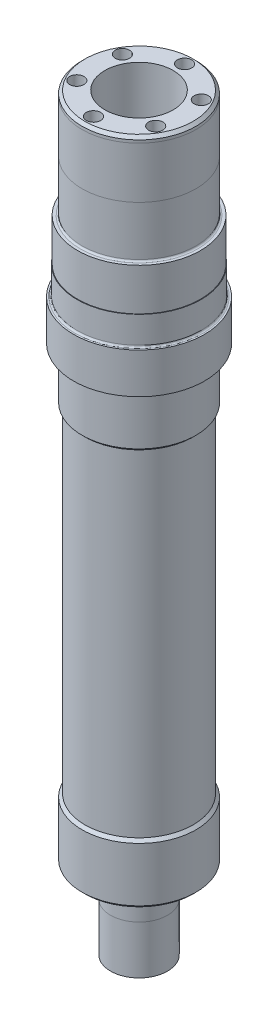
from build123d import *

# Parameters (mm, degrees)
SKETCH4_W                     = 1.6
SKETCH4_H                     = 120
M3_CLEARANCE_HOLE1_AT_2_COUNT = 2
M3_CLEARANCE_HOLE1_AT_2_PITCH = 8
M3_CLEARANCE_HOLE1_AT_3_COUNT = 2
M3_CLEARANCE_HOLE1_AT_3_PITCH = 13.856406461
M3_CLEARANCE_HOLE1_AT_4_COUNT = 2
M3_CLEARANCE_HOLE1_AT_4_PITCH = 16
M3_CLEARANCE_HOLE1_AT_5_COUNT = 2
M3_CLEARANCE_HOLE1_AT_5_PITCH = 13.856406461
M3_CLEARANCE_HOLE1_AT_6_COUNT = 2
M3_CLEARANCE_HOLE1_AT_6_PITCH = 8
M3_TAPPED_HOLE1_AT_2_COUNT    = 2
M3_TAPPED_HOLE1_AT_2_PITCH    = 8
M3_TAPPED_HOLE1_AT_3_COUNT    = 2
M3_TAPPED_HOLE1_AT_3_PITCH    = 13.856406461
M3_TAPPED_HOLE1_AT_4_COUNT    = 2
M3_TAPPED_HOLE1_AT_4_PITCH    = 8
M3_TAPPED_HOLE1_AT_5_COUNT    = 2
M3_TAPPED_HOLE1_AT_5_PITCH    = 13.856406461
M3_TAPPED_HOLE1_AT_6_COUNT    = 2
M3_TAPPED_HOLE1_AT_6_PITCH    = 16
SKETCH15_W                    = 1.6
SKETCH15_H                    = 134
M3_CLEARANCE_HOLE2_AT_2_COUNT = 2
M3_CLEARANCE_HOLE2_AT_2_PITCH = 8
M3_CLEARANCE_HOLE2_AT_3_COUNT = 2
M3_CLEARANCE_HOLE2_AT_3_PITCH = 13.856406461
M3_CLEARANCE_HOLE2_AT_4_COUNT = 2
M3_CLEARANCE_HOLE2_AT_4_PITCH = 16
M3_CLEARANCE_HOLE2_AT_5_COUNT = 2
M3_CLEARANCE_HOLE2_AT_5_PITCH = 13.856406461
M3_CLEARANCE_HOLE2_AT_6_COUNT = 2
M3_CLEARANCE_HOLE2_AT_6_PITCH = 8
M3_TAPPED_HOLE2_AT_2_COUNT    = 2
M3_TAPPED_HOLE2_AT_2_PITCH    = 8
M3_TAPPED_HOLE2_AT_3_COUNT    = 2
M3_TAPPED_HOLE2_AT_3_PITCH    = 13.856406461
M3_TAPPED_HOLE2_AT_4_COUNT    = 2
M3_TAPPED_HOLE2_AT_4_PITCH    = 16
M3_TAPPED_HOLE2_AT_5_COUNT    = 2
M3_TAPPED_HOLE2_AT_5_PITCH    = 13.856406461
M3_TAPPED_HOLE2_AT_6_COUNT    = 2
M3_TAPPED_HOLE2_AT_6_PITCH    = 8
CHAMFER1_SIZE                 = 0.5
FILLET1_R                     = 0.3
FILLET2_R                     = 0.3
FILLET3_R                     = 0.4
CHAMFER2_SIZE                 = 0.5
FILLET4_R                     = 0.3
FILLET5_R                     = 0.3


with BuildPart() as part:
    # Sketch1 → Revolve1 (revolve)
    with BuildSketch(Plane(origin=(0, 0, 0), x_dir=(0, 0, -1), z_dir=(1, 0, 0))):
        Polygon((-15, 84), (-15, 65), (-14.2, 65), (-14.2, 57.6), (-14.1, 57.6), (-14.1, 52.6), (-13.5, 52.6), (-13.5, 45.5), (-15, 45.5), (-15, 36.5), (-15.5, 36.5), (-15.5, -23.5), (-15, -23.5), (-15, -33.5), (-19, -33.5), (-20, -33.5), (-20, -47.5), (-25, -47.5), (-25, -23.5), (-19, -23.5), (-19, 83), (-19, 84), align=None)
    revolve(axis=Axis((0, -55.813956753, 25), (0, 1, 0)))

    # Sketch8 → M3 Tapped Hole1 (revolve, cut)
    with BuildSketch(Plane(origin=(0, -33.5, 17), x_dir=(0, 0, -1), z_dir=(1, 0, 0))):
        Polygon((0, 0), (0, 9.251075774), (1.25, 8.5), (1.25, 0), align=None)
    m3_tapped_hole1 = revolve(axis=Axis((0, -39.85, 17), (0, 1, 0)), mode=Mode.SUBTRACT)

    # M3 Tapped Hole1 at 2: M3 Tapped Hole1 ×2
    with Locations(*[Vector(0.8660254037844389, 0, 0.4999999999999998) * (i * M3_TAPPED_HOLE1_AT_2_PITCH) for i in range(1, M3_TAPPED_HOLE1_AT_2_COUNT)]):
        add(m3_tapped_hole1, mode=Mode.SUBTRACT)

    # M3 Tapped Hole1 at 3: M3 Tapped Hole1 ×2
    with Locations(*[Vector(0.4999999999999999, 0, 0.8660254037844387) * (i * M3_TAPPED_HOLE1_AT_3_PITCH) for i in range(1, M3_TAPPED_HOLE1_AT_3_COUNT)]):
        add(m3_tapped_hole1, mode=Mode.SUBTRACT)

    # M3 Tapped Hole1 at 4: M3 Tapped Hole1 ×2
    with Locations(*[Vector(-0.8660254037844389, 0, 0.49999999999999956) * (i * M3_TAPPED_HOLE1_AT_4_PITCH) for i in range(1, M3_TAPPED_HOLE1_AT_4_COUNT)]):
        add(m3_tapped_hole1, mode=Mode.SUBTRACT)

    # M3 Tapped Hole1 at 5: M3 Tapped Hole1 ×2
    with Locations(*[Vector(-0.5000000000000003, 0, 0.8660254037844385) * (i * M3_TAPPED_HOLE1_AT_5_PITCH) for i in range(1, M3_TAPPED_HOLE1_AT_5_COUNT)]):
        add(m3_tapped_hole1, mode=Mode.SUBTRACT)

    # M3 Tapped Hole1 at 6: M3 Tapped Hole1 ×2
    with Locations(*[(0, 0, i * M3_TAPPED_HOLE1_AT_6_PITCH) for i in range(1, M3_TAPPED_HOLE1_AT_6_COUNT)]):
        add(m3_tapped_hole1, mode=Mode.SUBTRACT)

    # Sketch20 → M3 Tapped Hole2 (revolve, cut)
    with BuildSketch(Plane(origin=(-6.92820323, 84, 29), x_dir=(0, 0, 1), z_dir=(1, 0, 0))):
        Polygon((0, 0), (0, 8.251075774), (1.25, 7.5), (1.25, 0), align=None)
    m3_tapped_hole2 = revolve(axis=Axis((-6.92820323, 90.35, 29), (0, -1, 0)), mode=Mode.SUBTRACT)

    # M3 Tapped Hole2 at 2: M3 Tapped Hole2 ×2
    with Locations(*[Vector(0.8660254037844393, 0, 0.49999999999999906) * (i * M3_TAPPED_HOLE2_AT_2_PITCH) for i in range(1, M3_TAPPED_HOLE2_AT_2_COUNT)]):
        add(m3_tapped_hole2, mode=Mode.SUBTRACT)

    # M3 Tapped Hole2 at 3: M3 Tapped Hole2 ×2
    with Locations(*[(i * M3_TAPPED_HOLE2_AT_3_PITCH, 0, 0) for i in range(1, M3_TAPPED_HOLE2_AT_3_COUNT)]):
        add(m3_tapped_hole2, mode=Mode.SUBTRACT)

    # M3 Tapped Hole2 at 4: M3 Tapped Hole2 ×2
    with Locations(*[Vector(0.8660254037844384, 0, -0.5000000000000006) * (i * M3_TAPPED_HOLE2_AT_4_PITCH) for i in range(1, M3_TAPPED_HOLE2_AT_4_COUNT)]):
        add(m3_tapped_hole2, mode=Mode.SUBTRACT)

    # M3 Tapped Hole2 at 5: M3 Tapped Hole2 ×2
    with Locations(*[Vector(0.4999999999999996, 0, -0.8660254037844389) * (i * M3_TAPPED_HOLE2_AT_5_PITCH) for i in range(1, M3_TAPPED_HOLE2_AT_5_COUNT)]):
        add(m3_tapped_hole2, mode=Mode.SUBTRACT)

    # M3 Tapped Hole2 at 6: M3 Tapped Hole2 ×2
    with Locations(*[(0, 0, -i * M3_TAPPED_HOLE2_AT_6_PITCH) for i in range(1, M3_TAPPED_HOLE2_AT_6_COUNT)]):
        add(m3_tapped_hole2, mode=Mode.SUBTRACT)

    # Chamfer1
    chamfer1_edges = [part.edges().sort_by_distance(p)[0] for p in [
        (0, 84, 35),
        (0, -33.5, 35),
    ]]
    chamfer(chamfer1_edges, length=CHAMFER1_SIZE)

    # Fillet3
    fillet3_edges = [part.edges().sort_by_distance(p)[0] for p in [
        (0, -33.5, 30),
    ]]
    fillet(fillet3_edges, radius=FILLET3_R)

    # Chamfer2
    chamfer2_edges = [part.edges().sort_by_distance(p)[0] for p in [
        (0, -23.5, 34.5),
        (0, 36.5, 34.5),
    ]]
    chamfer(chamfer2_edges, length=CHAMFER2_SIZE - 0.0001)  # a hair under: the kernel refuses the full size

    # Fillet4
    fillet4_edges = [part.edges().sort_by_distance(p)[0] for p in [
        (0, 65, 35),
        (0, 45.5, 35),
    ]]
    fillet(fillet4_edges, radius=FILLET4_R)

    # Fillet5
    fillet5_edges = [part.edges().sort_by_distance(p)[0] for p in [
        (0, 52.6, 35.9),
    ]]
    fillet(fillet5_edges, radius=FILLET5_R)


with BuildPart() as body_2:
    # Sketch2 → Revolve2 (revolve)
    with BuildSketch(Plane(origin=(0, 0, 0), x_dir=(0, 0, -1), z_dir=(1, 0, 0))):
        Polygon((-19, -36), (-13, -36), (-13, -32.5), (-15, -32.5), (-15, -34), (-19, -34), align=None)
    revolve(axis=Axis((0, -55.813956753, 25), (0, 1, 0)))

    # Sketch4 → M3 Clearance Hole1 (revolve, cut)
    with BuildSketch(Plane(origin=(6.92820323, -36, 21), x_dir=(0, 0, -1), z_dir=(1, 0, 0))):
        with Locations((0.8, 60)):
            Rectangle(SKETCH4_W, SKETCH4_H)
    m3_clearance_hole1 = revolve(axis=Axis((6.92820323, -42.35, 21), (0, 1, 0)), mode=Mode.SUBTRACT)

    # M3 Clearance Hole1 at 2: M3 Clearance Hole1 ×2
    with Locations(*[Vector(-0.8660254037844389, 0, -0.4999999999999998) * (i * M3_CLEARANCE_HOLE1_AT_2_PITCH) for i in range(1, M3_CLEARANCE_HOLE1_AT_2_COUNT)]):
        add(m3_clearance_hole1, mode=Mode.SUBTRACT)

    # M3 Clearance Hole1 at 3: M3 Clearance Hole1 ×2
    with Locations(*[(-i * M3_CLEARANCE_HOLE1_AT_3_PITCH, 0, 0) for i in range(1, M3_CLEARANCE_HOLE1_AT_3_COUNT)]):
        add(m3_clearance_hole1, mode=Mode.SUBTRACT)

    # M3 Clearance Hole1 at 4: M3 Clearance Hole1 ×2
    with Locations(*[Vector(-0.8660254037844389, 0, 0.4999999999999996) * (i * M3_CLEARANCE_HOLE1_AT_4_PITCH) for i in range(1, M3_CLEARANCE_HOLE1_AT_4_COUNT)]):
        add(m3_clearance_hole1, mode=Mode.SUBTRACT)

    # M3 Clearance Hole1 at 5: M3 Clearance Hole1 ×2
    with Locations(*[Vector(-0.5000000000000004, 0, 0.8660254037844385) * (i * M3_CLEARANCE_HOLE1_AT_5_PITCH) for i in range(1, M3_CLEARANCE_HOLE1_AT_5_COUNT)]):
        add(m3_clearance_hole1, mode=Mode.SUBTRACT)

    # M3 Clearance Hole1 at 6: M3 Clearance Hole1 ×2
    with Locations(*[(0, 0, i * M3_CLEARANCE_HOLE1_AT_6_PITCH) for i in range(1, M3_CLEARANCE_HOLE1_AT_6_COUNT)]):
        add(m3_clearance_hole1, mode=Mode.SUBTRACT)

    # Fillet2
    fillet2_edges = [body_2.edges().sort_by_distance(p)[0] for p in [
        (0, -34, 35),
    ]]
    fillet(fillet2_edges, radius=FILLET2_R)


with BuildPart() as body_3:
    # Sketch13 → Revolve4 (revolve)
    with BuildSketch(Plane(origin=(0, 0, 0), x_dir=(0, 0, -1), z_dir=(1, 0, 0))):
        Polygon((-19, 86.5), (-13, 86.5), (-13, 83), (-15, 83), (-15, 84.5), (-19, 84.5), align=None)
    revolve(axis=Axis((0, -55.813956753, 25), (0, 1, 0)))

    # Sketch15 → M3 Clearance Hole2 (revolve, cut)
    with BuildSketch(Plane(origin=(-6.92820323, 86.5, 21), x_dir=(0, 0, 1), z_dir=(1, 0, 0))):
        with Locations((0.8, 67)):
            Rectangle(SKETCH15_W, SKETCH15_H)
    m3_clearance_hole2 = revolve(axis=Axis((-6.92820323, 92.85, 21), (0, -1, 0)), mode=Mode.SUBTRACT)

    # M3 Clearance Hole2 at 2: M3 Clearance Hole2 ×2
    with Locations(*[Vector(0.8660254037844392, 0, -0.49999999999999933) * (i * M3_CLEARANCE_HOLE2_AT_2_PITCH) for i in range(1, M3_CLEARANCE_HOLE2_AT_2_COUNT)]):
        add(m3_clearance_hole2, mode=Mode.SUBTRACT)

    # M3 Clearance Hole2 at 3: M3 Clearance Hole2 ×2
    with Locations(*[(i * M3_CLEARANCE_HOLE2_AT_3_PITCH, 0, 0) for i in range(1, M3_CLEARANCE_HOLE2_AT_3_COUNT)]):
        add(m3_clearance_hole2, mode=Mode.SUBTRACT)

    # M3 Clearance Hole2 at 4: M3 Clearance Hole2 ×2
    with Locations(*[Vector(0.8660254037844386, 0, 0.5000000000000003) * (i * M3_CLEARANCE_HOLE2_AT_4_PITCH) for i in range(1, M3_CLEARANCE_HOLE2_AT_4_COUNT)]):
        add(m3_clearance_hole2, mode=Mode.SUBTRACT)

    # M3 Clearance Hole2 at 5: M3 Clearance Hole2 ×2
    with Locations(*[Vector(0.4999999999999999, 0, 0.8660254037844387) * (i * M3_CLEARANCE_HOLE2_AT_5_PITCH) for i in range(1, M3_CLEARANCE_HOLE2_AT_5_COUNT)]):
        add(m3_clearance_hole2, mode=Mode.SUBTRACT)

    # M3 Clearance Hole2 at 6: M3 Clearance Hole2 ×2
    with Locations(*[(0, 0, i * M3_CLEARANCE_HOLE2_AT_6_PITCH) for i in range(1, M3_CLEARANCE_HOLE2_AT_6_COUNT)]):
        add(m3_clearance_hole2, mode=Mode.SUBTRACT)

    # Fillet1
    fillet1_edges = [body_3.edges().sort_by_distance(p)[0] for p in [
        (0, 84.5, 35),
    ]]
    fillet(fillet1_edges, radius=FILLET1_R)


solid = part.part
